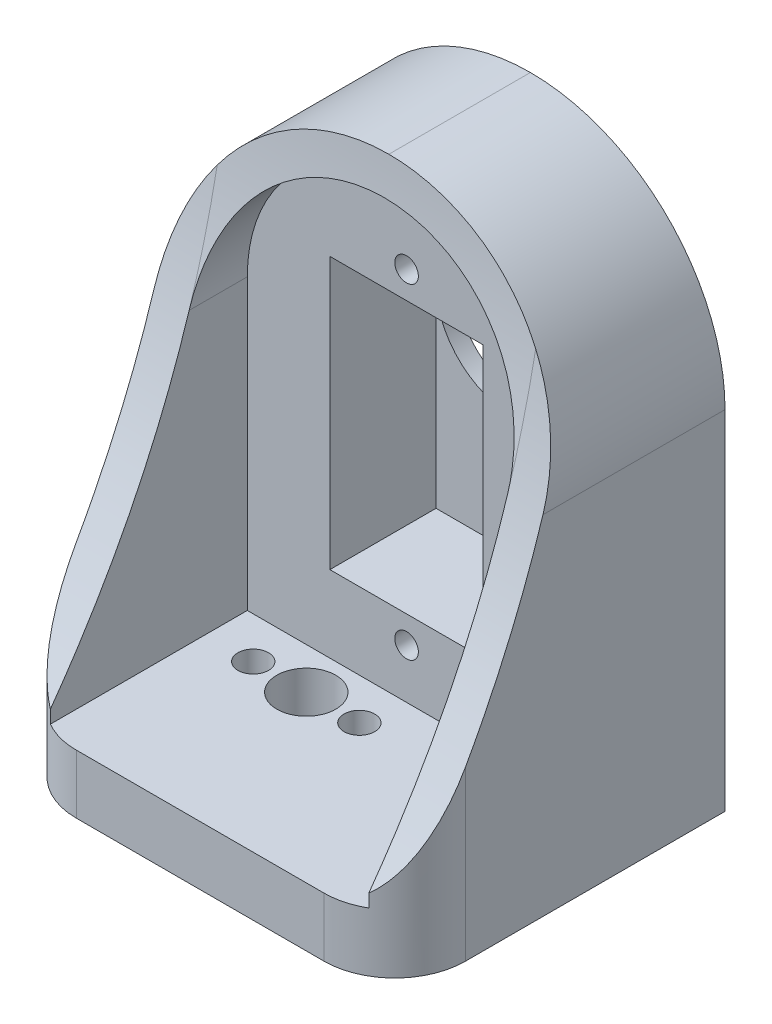
from build123d import *

# Parameters (mm, degrees)
SKETCH2_W           = 33
SKETCH2_H           = 28
BOSS_EXTRUDE1_DEPTH = 46
SKETCH3_W           = 17.5
SKETCH3_H           = 41
CUT_EXTRUDE1_DEPTH  = 46
BOSS_EXTRUDE2_DEPTH = 3
BOSS_EXTRUDE3_REACH = 58.675
FILLET1_START       = -3.5
FILLET1_DEPTH       = 4.934820146
FILLET1_START_2     = -13.5
FILLET1_2_DEPTH     = 27
FILLET2_R           = 16.5
FILLET3_R           = 6
SKETCH6_W           = 13
SKETCH6_H           = 23
CUT_EXTRUDE2_DEPTH  = 9
SKETCH7_R           = 6.5
CUT_EXTRUDE3_DEPTH  = 9
SKETCH8_R           = 1
CUT_EXTRUDE4_DEPTH  = 8
SKETCH9_R           = 1.3
SKETCH9_R_2         = 2.5
CUT_EXTRUDE5_DEPTH  = 47.360004726


with BuildPart() as part:
    # Sketch2 → Boss-Extrude1 (new body)
    with BuildSketch(Plane(origin=(0, 0, 0), x_dir=(1, 0, 0), z_dir=(0, 1, 0))):
        Rectangle(SKETCH2_W, SKETCH2_H)
    extrude(amount=BOSS_EXTRUDE1_DEPTH)

    # Sketch3 → Cut-Extrude1 (cut)
    with BuildSketch(Plane(origin=(16.5, 0, 0), x_dir=(0, 0, -1), z_dir=(1, 0, 0))):
        with Locations((-5.25, 25.5)):
            Rectangle(SKETCH3_W, SKETCH3_H)
    extrude(amount=-CUT_EXTRUDE1_DEPTH, mode=Mode.SUBTRACT)

    # Sketch4 → Boss-Extrude2 (add)
    with BuildSketch(Plane(origin=(16.5, 0, 0), x_dir=(0, 0, -1), z_dir=(1, 0, 0))):
        with BuildLine():
            Line((3.5, 46), (2, 46))
            add(Edge.make_bspline(
                [(-14, 5), (-0.513369381, 23.145305793), (2, 46)],
                knots=[0, 0, 0, 1, 1, 1], degree=2))
            Line((-14, 5), (3.5, 5))
            Line((3.5, 5), (3.5, 46))
        make_face()
    boss_extrude2 = extrude(amount=-BOSS_EXTRUDE2_DEPTH)

    # Mirror1: Boss-Extrude2 across plane
    add(boss_extrude2.mirror(Plane(origin=(0, 0, 0), x_dir=(0, 0, 1), z_dir=(1, 0, 0))))

    # Boss-Extrude3: up to this face of the body (flat: up to its plane)
    boss_extrude3_end = Plane(part.part.faces().sort_by_distance((-13.5, 18.213858907, 1.639358486))[0])
    # Sketch5 → Boss-Extrude3 (add, up to the picked face)
    with BuildSketch(Plane.ZY.offset(-13.5), mode=Mode.PRIVATE) as boss_extrude3_sk1:
        with BuildLine():
            Line((-3.5, 43), (-1.619905063, 43))
            add(Edge.make_bspline(
                [(-1.619905063, 43), (-1.833911679, 44.489717492), (-2.000000005, 46.00000005)],
                knots=[0, 0, 0, 1, 1, 1], degree=2))
            Line((-2.000000005, 46.00000005), (-3.5, 46))
            Line((-3.5, 46), (-3.5, 43))
        make_face()
    boss_extrude3_tool1 = split(extrude(boss_extrude3_sk1.sketch, amount=BOSS_EXTRUDE3_REACH, mode=Mode.PRIVATE), bisect_by=boss_extrude3_end, keep=Keep.BOTH, mode=Mode.PRIVATE)
    add(boss_extrude3_tool1.solids().sort_by(Axis((13.5, 44.443503, -2.655604), (-1, 0, 0)))[0])

    # Fillet1: read off the stored shape, not the designer's step
    # Fillet1 outline → Fillet1 (add)
    with BuildSketch(Plane.XY.offset(FILLET1_START)):
        with BuildLine():
            ThreePointArc((-13.5, 29.5), (-9.545941546, 39.045941546), (0, 43))
            Line((0, 43), (-13.5, 43))
            Line((-13.5, 43), (-13.5, 29.5))
        make_face()
        with BuildLine():
            ThreePointArc((0, 43), (9.545941546, 39.045941546), (13.5, 29.5))
            Line((13.5, 29.5), (13.5, 43))
            Line((13.5, 43), (0, 43))
        make_face()
    extrude(amount=FILLET1_DEPTH)

    # Fillet1 2 outline → Fillet1 2 (cut)
    with BuildSketch(Plane.YZ.offset(FILLET1_START_2)):
        with BuildLine():
            Line((43, 1.434820146), (29.5, 1.434820046))
            add(Edge.make_bspline(
                [(29.5, 1.434820046), (36.024557501, -0.617842021), (43, -1.619905063)],
                knots=[0.500321207, 0.500321207, 0.500321207, 0.500855825, 0.500855825, 0.500855825], degree=2))
            Line((43, -1.619905063), (43, 1.434820146))
        make_face()
    extrude(amount=FILLET1_2_DEPTH, mode=Mode.SUBTRACT)

    # Fillet2
    # the kernel refuses this fillet: 16.5 mm, written as the material it takes off along each edge
    with BuildSketch(Plane(origin=(16.5, 46, -55.25), x_dir=(0, -1, 0), z_dir=(0, 0, 1)), Plane(origin=(-16.5, 46, 39.25), x_dir=(0, -1, 0), z_dir=(0, 0, -1))) as fillet2_piece_1:
        with BuildLine():
            CenterArc((FILLET2_R, -FILLET2_R), FILLET2_R, 90, 90)
            Line((0, -FILLET2_R), (0, 0))
            Line((0, 0), (FILLET2_R, 0))
        make_face()
    extrude(amount=94.5, mode=Mode.SUBTRACT)

    # Fillet3
    # the kernel refuses this fillet: 6 mm, written as the material it takes off along each edge
    with BuildSketch(Plane(origin=(-16.5, -15, 14), x_dir=(1, 0, 0), z_dir=(0, 1, 0)), Plane(origin=(16.5, -15, 14), x_dir=(0, 0, -1), z_dir=(0, 1, 0))) as fillet3_piece_1:
        with BuildLine():
            CenterArc((FILLET3_R, FILLET3_R), FILLET3_R, 180, 90)
            Line((0, FILLET3_R), (0, 0))
            Line((0, 0), (FILLET3_R, 0))
        make_face()
    extrude(amount=35, mode=Mode.SUBTRACT)

    # Sketch6 → Cut-Extrude2 (cut)
    with BuildSketch(Plane.XY.offset(-3.5)):
        with Locations((0, 23)):
            Rectangle(SKETCH6_W, SKETCH6_H)
    extrude(amount=-CUT_EXTRUDE2_DEPTH, mode=Mode.SUBTRACT)

    # Sketch7 → Cut-Extrude3 (cut)
    with BuildSketch(Plane.XY.offset(-12.5)):
        with Locations((0, 28)):
            Circle(SKETCH7_R)
    extrude(amount=-CUT_EXTRUDE3_DEPTH, mode=Mode.SUBTRACT)

    # Sketch8 → Cut-Extrude4 (cut)
    with BuildSketch(Plane.XY.offset(-3.5)):
        with Locations((0, 36.8)):
            Circle(SKETCH8_R)
        with Locations((0, 9.2)):
            Circle(SKETCH8_R)
    extrude(amount=-CUT_EXTRUDE4_DEPTH, mode=Mode.SUBTRACT)

    # Sketch9 → Cut-Extrude5 (cut, through all)
    with BuildSketch(Plane(origin=(0, 5, 0), x_dir=(1, 0, 0), z_dir=(0, 1, 0))):
        with Locations(Location((-0.5, 0, 0), (0, 0, 270))):
            Circle(SKETCH9_R)
        with Locations(Location((-5, 0, 0), (0, 0, 270))):
            Circle(SKETCH9_R_2)
        with Locations(Location((-9.5, 0, 0), (0, 0, 270))):
            Circle(SKETCH9_R)
    extrude(amount=-CUT_EXTRUDE5_DEPTH, mode=Mode.SUBTRACT)


solid = part.part
